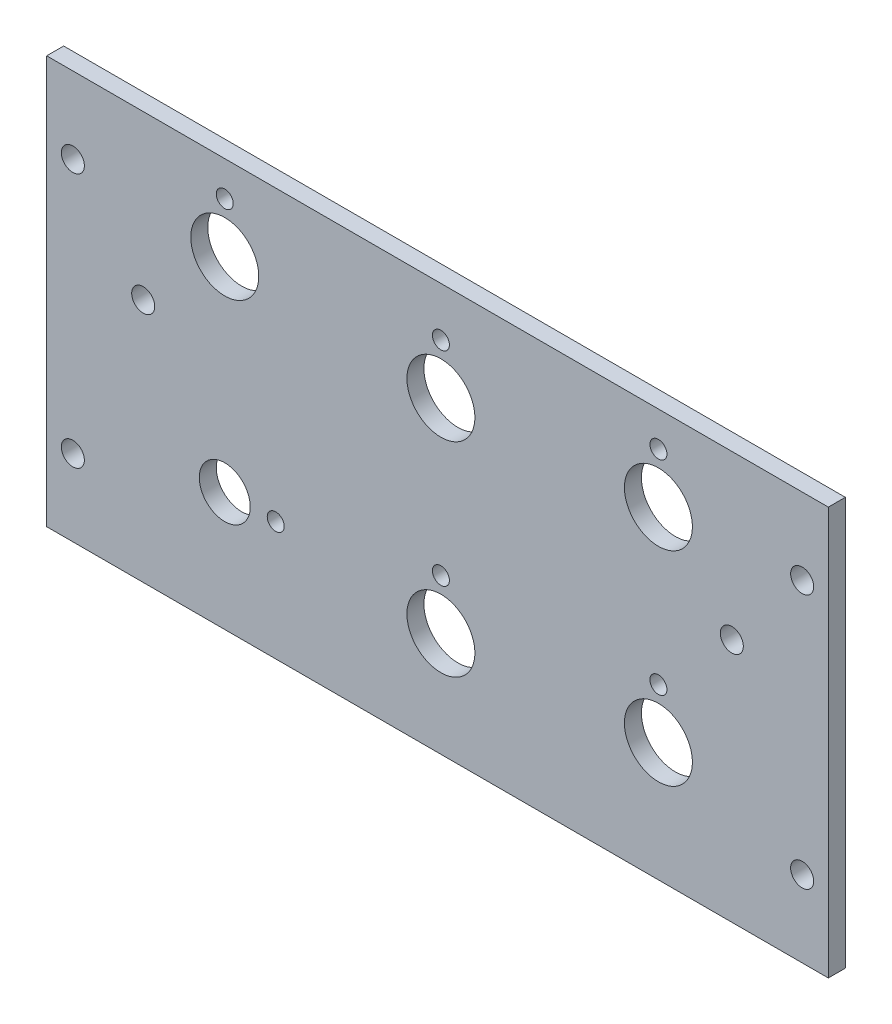
from build123d import *

# Parameters (mm, degrees)
SKETCH1_W                    = 146.05
SKETCH1_H                    = 76.2
BOSS_EXTRUDE1_DEPTH          = 3.175
F_6_CLEARANCE_HOLE1_D        = 4.3053
F_3_8_0_375_DIAMETER_HOLE1_D = 9.525
F_1_2_0_5_DIAMETER_HOLE1_D   = 12.7
F_1_8_0_125_DIAMETER_HOLE1_D = 3.175


with BuildPart() as part:
    # Sketch1 → Boss-Extrude1 (new body)
    with BuildSketch(Plane.XY):
        with Locations((-73.025, 38.1)):
            Rectangle(SKETCH1_W, SKETCH1_H)
    extrude(amount=-BOSS_EXTRUDE1_DEPTH)

    # #6 Clearance Hole1 (through all)
    with Locations(Plane(origin=(0, 0, -3.175), x_dir=(-1, 0, 0), z_dir=(0, 0, -1))):
        with Locations((4.8895, 61.9125), (4.8895, 14.2875), (141.1605, 14.2875), (141.1605, 61.9125), (128.016, 45.72), (18.034, 45.72)):
            Hole(F_6_CLEARANCE_HOLE1_D / 2)

    # 3/8 (0.375) Diameter Hole1 (through all)
    with Locations(Plane(origin=(0, 0, -3.175), x_dir=(-1, 0, 0), z_dir=(0, 0, -1))):
        with Locations((112.776, 22.225)):
            Hole(F_3_8_0_375_DIAMETER_HOLE1_D / 2)

    # 1/2 (0.5) Diameter Hole1 (through all)
    with Locations(Plane(origin=(0, 0, -3.175), x_dir=(-1, 0, 0), z_dir=(0, 0, -1))):
        with Locations((31.75, 60.325), (72.39, 57.658), (112.776, 60.325), (31.75, 22.225), (72.39, 19.558)):
            Hole(F_1_2_0_5_DIAMETER_HOLE1_D / 2)

    # 1/8 (0.125) Diameter Hole1 (through all)
    with Locations(Plane(origin=(0, 0, -3.175), x_dir=(-1, 0, 0), z_dir=(0, 0, -1))):
        with Locations((31.75, 69.699492067), (112.776, 69.699492067), (103.251, 22.225), (72.39, 67.032492067), (31.75, 31.599492067), (72.39, 28.932492067)):
            Hole(F_1_8_0_125_DIAMETER_HOLE1_D / 2)


solid = part.part
